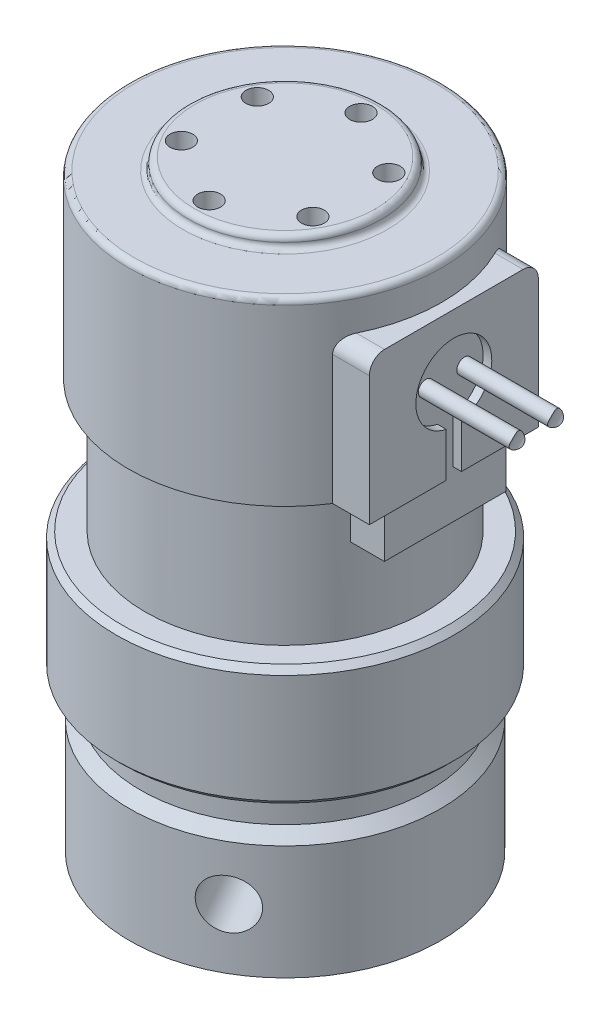
from build123d import *

# Parameters (mm, degrees)
CUT_EXTRUDE1_START             = -29.859510257
CUT_EXTRUDE1_OUTLINE_R         = 9.525
CUT_EXTRUDE1_DEPTH             = 38.80625
CUT_EXTRUDE1_START_2           = -19.623310357
CUT_EXTRUDE1_2_OUTLINE_R       = 10.2362
CUT_EXTRUDE1_2_OUTLINE_R_2     = 9.525
CUT_EXTRUDE1_2_DEPTH           = 28.5700501
CUT_EXTRUDE1_START_3           = -19.534410257
CUT_EXTRUDE1_3_OUTLINE_R       = 10.2362
CUT_EXTRUDE1_3_DEPTH           = 7.9248
CUT_EXTRUDE1_4_OUTLINE_R       = 10.2362
CUT_EXTRUDE1_4_OUTLINE_R_2     = 9.525
CUT_EXTRUDE1_4_DEPTH           = 7.5267999
CUT_EXTRUDE1_START_4           = -11.609610257
CUT_EXTRUDE1_5_OUTLINE_R       = 10.2362
CUT_EXTRUDE1_5_DEPTH           = 11.609610257
CUT_EXTRUDE1_START_5           = 4.949489743
CUT_EXTRUDE1_6_OUTLINE_R       = 10.2362
CUT_EXTRUDE1_6_DEPTH           = 3.99725
CUT_EXTRUDE1_START_6           = 6.730338354
CUT_EXTRUDE1_7_DEPTH           = 4.382161646
CUT_EXTRUDE1_START_7           = 9.523588486
CUT_EXTRUDE1_8_DEPTH           = 1.017411514
CUT_EXTRUDE1_START_8           = 29.859510257
CUT_EXTRUDE1_9_DEPTH           = 4.949489743
CUT_EXTRUDE2_DEPTH             = 7.9248
SKETCH3_R                      = 6.681
SKETCH3_R_2                    = 4.319
CUT_EXTRUDE3_DEPTH             = 1
CUT_EXTRUDE4_DEPTH             = 8.7001
CUT_EXTRUDE5_START             = -2.35625
CUT_EXTRUDE5_DEPTH             = 2.35625
CUT_EXTRUDE6_DEPTH             = 7.9248
CUT_EXTRUDE7_DEPTH             = 5.5372
SKETCH8_R                      = 2.413
BOSS_EXTRUDE1_DEPTH            = 3.675390567
BOSS_EXTRUDE2_REACH            = 48.481
BOSS_EXTRUDE2_END_RADIUS       = 0.85
SKETCH9_R                      = 0.5
BOSS_EXTRUDE3_REACH            = 48.481
BOSS_EXTRUDE3_END_RADIUS       = 0.85
SKETCH10_R                     = 0.5
M2_CLEARANCE_HOLE1_D           = 2.362
M2_CLEARANCE_HOLE1_DEPTH       = 9
HOLE1_D                        = 0.635
HOLE1_DEPTH                    = 14
F_1_5_1_5_DIAMETER_HOLE1_D     = 1.5
F_1_5_1_5_DIAMETER_HOLE1_DEPTH = 1.6
M3_CLEARANCE_HOLE1_D           = 3.2512
M3_CLEARANCE_HOLE1_DEPTH       = 4.99995
M3_CLEARANCE_HOLE2_D           = 3.2512
M3_CLEARANCE_HOLE2_DEPTH       = 4.99995
M3_CLEARANCE_HOLE3_D           = 3.2512
M3_CLEARANCE_HOLE3_DEPTH       = 4.99995
CHAMFER1_SIZE                  = 0.381
CHAMFER2_SIZE                  = 0.498
FILLET1_R                      = 0.386030378
FILLET2_R                      = 1


with BuildPart() as part:
    # Cut-Extrude1: read off the stored shape, not the designer's step
    # Cut-Extrude1 outline → Cut-Extrude1 (new body)
    with BuildSketch(Plane(origin=(0, 29.859510257, 0), x_dir=(-1, 0, 0), z_dir=(0, 1, 0)).offset(CUT_EXTRUDE1_START)):
        Circle(CUT_EXTRUDE1_OUTLINE_R)
    extrude(amount=CUT_EXTRUDE1_DEPTH)

    # Cut-Extrude1 2 outline → Cut-Extrude1 2 (add)
    with BuildSketch(Plane(origin=(0, 29.859510257, 0), x_dir=(-1, 0, 0), z_dir=(0, 1, 0)).offset(CUT_EXTRUDE1_START_2)):
        Circle(CUT_EXTRUDE1_2_OUTLINE_R)
        Circle(CUT_EXTRUDE1_2_OUTLINE_R_2, mode=Mode.SUBTRACT)
    extrude(amount=CUT_EXTRUDE1_2_DEPTH)

    # Cut-Extrude1 3 outline → Cut-Extrude1 3 (add)
    with BuildSketch(Plane(origin=(0, 29.859510257, 0), x_dir=(-1, 0, 0), z_dir=(0, 1, 0)).offset(CUT_EXTRUDE1_START_3)):
        with BuildLine():
            Line((-11.101245707, -0.5), (-11.1125, -0.5))
            Line((-11.1125, -0.5), (-11.1125, -5.5625))
            Line((-11.1125, -5.5625), (-9.620096153, -5.5625))
            ThreePointArc((-9.620096153, -5.5625), (10.665398665, 3.120405033), (-11.101245707, -0.5))
        make_face()
        Circle(CUT_EXTRUDE1_3_OUTLINE_R, mode=Mode.SUBTRACT)
    extrude(amount=CUT_EXTRUDE1_3_DEPTH)

    # Cut-Extrude1 4 outline → Cut-Extrude1 4 (add)
    with BuildSketch(Plane(origin=(0, 29.859510257, 0), x_dir=(-1, 0, 0), z_dir=(0, 1, 0)).offset(CUT_EXTRUDE1_START)):
        Circle(CUT_EXTRUDE1_4_OUTLINE_R)
        Circle(CUT_EXTRUDE1_4_OUTLINE_R_2, mode=Mode.SUBTRACT)
    extrude(amount=CUT_EXTRUDE1_4_DEPTH)

    # Cut-Extrude1 5 outline → Cut-Extrude1 5 (add)
    with BuildSketch(Plane(origin=(0, 29.859510257, 0), x_dir=(-1, 0, 0), z_dir=(0, 1, 0)).offset(CUT_EXTRUDE1_START_4)):
        with BuildLine():
            Line((-10.541, -0.5), (-11.1125, -0.5))
            Line((-11.1125, -0.5), (-11.1125, -5.5625))
            Line((-11.1125, -5.5625), (-8.691098625, -5.5625))
            ThreePointArc((-8.691098625, -5.5625), (10.31875, 0), (-8.691098625, 5.5625))
            Line((-8.691098625, 5.5625), (-11.1125, 5.5625))
            Line((-11.1125, 5.5625), (-11.1125, 0.5))
            Line((-11.1125, 0.5), (-10.541, 0.5))
            Line((-10.541, 0.5), (-10.541, -0.5))
        make_face()
        Circle(CUT_EXTRUDE1_5_OUTLINE_R, mode=Mode.SUBTRACT)
    extrude(amount=CUT_EXTRUDE1_5_DEPTH)

    # Cut-Extrude1 6 outline → Cut-Extrude1 6 (add)
    with BuildSketch(Plane(origin=(0, 29.859510257, 0), x_dir=(-1, 0, 0), z_dir=(0, 1, 0)).offset(CUT_EXTRUDE1_START_5)):
        with BuildLine():
            Line((-11.1125, -5.5625), (-8.691098625, -5.5625))
            ThreePointArc((-8.691098625, -5.5625), (10.31875, 0), (-8.691098625, 5.5625))
            Line((-8.691098625, 5.5625), (-11.1125, 5.5625))
            Line((-11.1125, 5.5625), (-11.1125, -5.5625))
        make_face()
        Circle(CUT_EXTRUDE1_6_OUTLINE_R, mode=Mode.SUBTRACT)
    extrude(amount=CUT_EXTRUDE1_6_DEPTH)

    # Cut-Extrude1 7 outline → Cut-Extrude1 7 (add)
    with BuildSketch(Plane.YZ.offset(CUT_EXTRUDE1_START_6)):
        with BuildLine():
            Line((34.809, 0), (34.809, 5.5625))
            Line((34.809, 5.5625), (29.859510257, 5.5625))
            Line((29.859510257, 5.5625), (29.859510257, 0.5))
            ThreePointArc((29.859510257, 0.5), (32.560272405, 2.487340383), (34.809, 0))
        make_face()
        with BuildLine():
            Line((34.809, -5.5625), (34.809, 0))
            ThreePointArc((34.809, 0), (32.560272405, -2.487340383), (29.859510257, -0.5))
            Line((29.859510257, -0.5), (29.859510257, -5.5625))
            Line((29.859510257, -5.5625), (34.809, -5.5625))
        make_face()
    extrude(amount=CUT_EXTRUDE1_7_DEPTH)

    # Cut-Extrude1 8 outline → Cut-Extrude1 8 (add)
    with BuildSketch(Plane.YZ.offset(CUT_EXTRUDE1_START_7)):
        with BuildLine():
            ThreePointArc((29.859510257, -0.5), (34.809, 0), (29.859510257, 0.5))
            Line((29.859510257, 0.5), (29.859510257, -0.5))
        make_face()
    extrude(amount=CUT_EXTRUDE1_8_DEPTH)

    # Cut-Extrude1 9 outline → Cut-Extrude1 9 (add)
    with BuildSketch(Plane(origin=(0, 0, 0), x_dir=(1, 0, 0), z_dir=(0, 1, 0)).offset(CUT_EXTRUDE1_START_8)):
        with BuildLine():
            ThreePointArc((8.592926404, -5.5625), (-10.2362, 0), (8.592926404, 5.5625))
            Line((8.592926404, 5.5625), (8.691098625, 5.5625))
            ThreePointArc((8.691098625, 5.5625), (-10.31875, 0), (8.691098625, -5.5625))
            Line((8.691098625, -5.5625), (8.592926404, -5.5625))
        make_face()
    extrude(amount=CUT_EXTRUDE1_9_DEPTH)

    # Cut-Extrude1 10 outline → Cut-Extrude1 10 (revolve)
    with BuildSketch(Plane.XY):
        Polygon((10.2362, 7.5268), (9.525, 8.238), (9.525, 7.5267999), align=None)
        Polygon((9.525, 10.2361999), (9.525, 9.525), (10.2362, 10.2362), align=None)
        with BuildLine():
            ThreePointArc((8.609999999, -0.324609433), (8.744308814, -0.177391442), (8.835106781, 0))
            Line((8.835106781, 0), (7.420893219, 0))
            ThreePointArc((7.420893219, 0), (7.511691186, -0.177391442), (7.646000001, -0.324609433))
            Line((7.646000001, -0.324609433), (8.609999999, -0.324609433))
        make_face()
        with BuildLine():
            ThreePointArc((8.128000003, -0.5), (8.384459477, -0.454789711), (8.609999999, -0.324609433))
            Line((8.609999999, -0.324609433), (7.646000001, -0.324609433))
            ThreePointArc((7.646000001, -0.324609433), (7.871540526, -0.454789712), (8.128000003, -0.5))
        make_face()
        with BuildLine():
            ThreePointArc((3.376999999, -0.324609433), (3.511308814, -0.177391442), (3.602106781, 0))
            Line((3.602106781, 0), (0, 0))
            Line((0, 0), (0, -0.324609433))
            Line((0, -0.324609433), (2.413, -0.324609433))
            Line((2.413, -0.324609433), (3.376999999, -0.324609433))
        make_face()
        with BuildLine():
            ThreePointArc((2.895, -0.5), (3.151459475, -0.454789711), (3.376999999, -0.324609433))
            Line((3.376999999, -0.324609433), (2.413, -0.324609433))
            ThreePointArc((2.413, -0.324609433), (2.638540524, -0.454789711), (2.895, -0.5))
        make_face()
        with BuildLine():
            Line((3.602106781, 39.60008858), (3.602106781, 38.80625))
            Line((3.602106781, 38.80625), (6.693887254, 38.80625))
            ThreePointArc((6.693887254, 38.80625), (6.437149688, 38.931287401), (6.349669127, 39.203125))
            ThreePointArc((6.349669127, 39.203125), (6.23566623, 39.486273695), (5.952406329, 39.6))
            Line((5.952406329, 39.6), (3.602106781, 39.60008858))
        make_face()
        Polygon((0, 38.80625), (3.602106781, 38.80625), (3.602106781, 39.60008858), (0, 39.6), align=None)
    revolve(axis=Axis((0, 0, 0), (0, 1, 0)))

    # Cut-Extrude1 11 outline → Cut-Extrude1 11 (revolve, cut)
    with BuildSketch(Plane.XY):
        with BuildLine():
            ThreePointArc((6.693887254, 38.80625), (6.712112754, 38.805793407), (6.730338254, 38.80625))
            Line((6.730338254, 38.80625), (6.693887254, 38.80625))
        make_face()
    revolve(axis=Axis((0, 0, 0), (0, 1, 0)), mode=Mode.SUBTRACT)

    # Sketch2 → Cut-Extrude2 (cut)
    with BuildSketch(Plane.XZ.offset(-10.3251)):
        with BuildLine():
            Line((11.1125, -0.5), (11.101245707, -0.5))
            ThreePointArc((11.101245707, -0.5), (10.92581766, -2.028340381), (10.541, -3.517808302))
            Line((10.541, -3.517808302), (10.541, -4))
            Line((10.541, -4), (10.367625391, -4))
            ThreePointArc((10.367625391, -4), (10.024350587, -4.795836898), (9.620096153, -5.5625))
            Line((9.620096153, -5.5625), (11.1125, -5.5625))
            Line((11.1125, -5.5625), (11.1125, -0.5))
        make_face()
    extrude(amount=-CUT_EXTRUDE2_DEPTH, mode=Mode.SUBTRACT)

    # Sketch3 → Cut-Extrude3 (cut)
    with BuildSketch(Plane.XZ):
        with Locations(Location((0, 0, 0), (0, 0, 90))):
            Circle(SKETCH3_R)
        with Locations(Location((0, 0, 0), (0, 0, 90))):
            Circle(SKETCH3_R_2, mode=Mode.SUBTRACT)
    extrude(amount=-CUT_EXTRUDE3_DEPTH, mode=Mode.SUBTRACT)

    # Sketch4 → Cut-Extrude4 (cut)
    with BuildSketch(Plane.XZ.offset(-18.2499)):
        with BuildLine():
            Line((10.541, -4), (8.307129468, -4))
            ThreePointArc((8.307129468, -4), (-9.22, 0), (8.307129468, 4))
            Line((8.307129468, 4), (10.541, 4))
            Line((10.541, 4), (10.541, 0.5))
            Line((10.541, 0.5), (11.1125, 0.5))
            Line((11.1125, 0.5), (11.1125, 5.5625))
            Line((11.1125, 5.5625), (8.691098625, 5.5625))
            ThreePointArc((8.691098625, 5.5625), (-10.31875, 0), (8.691098625, -5.5625))
            Line((8.691098625, -5.5625), (11.1125, -5.5625))
            Line((11.1125, -5.5625), (11.1125, -0.5))
            Line((11.1125, -0.5), (10.541, -0.5))
            Line((10.541, -0.5), (10.541, -4))
        make_face()
    extrude(amount=-CUT_EXTRUDE4_DEPTH, mode=Mode.SUBTRACT)

    # Sketch5 → Cut-Extrude5 (cut)
    with BuildSketch(Plane(origin=(0, 38.80625, 0), x_dir=(-1, 0, 0), z_dir=(0, 1, 0)).offset(CUT_EXTRUDE5_START)):
        with BuildLine():
            Line((-8.691098625, 5.5625), (-11.1125, 5.5625))
            Line((-11.1125, 5.5625), (-11.1125, -5.5625))
            Line((-11.1125, -5.5625), (-8.691098625, -5.5625))
            ThreePointArc((-8.691098625, -5.5625), (-10.31875, 0), (-8.691098625, 5.5625))
        make_face()
    extrude(amount=CUT_EXTRUDE5_DEPTH, mode=Mode.SUBTRACT)

    # Sketch6 → Cut-Extrude6 (cut)
    with BuildSketch(Plane.XZ.offset(-10.3251)):
        with BuildLine():
            Line((10.541, -4), (10.541, -3.517808302))
            ThreePointArc((10.541, -3.517808302), (10.457092385, -3.759903603), (10.367625391, -4))
            Line((10.367625391, -4), (10.541, -4))
        make_face()
    extrude(amount=-CUT_EXTRUDE6_DEPTH, mode=Mode.SUBTRACT)

    # Sketch7 → Cut-Extrude7 (cut)
    with BuildSketch(Plane.XZ.offset(-18.2499)):
        with BuildLine():
            Line((10.541, 4), (8.307129468, 4))
            ThreePointArc((8.307129468, 4), (9.22, 0), (8.307129468, -4))
            Line((8.307129468, -4), (10.541, -4))
            Line((10.541, -4), (10.541, 4))
        make_face()
    extrude(amount=-CUT_EXTRUDE7_DEPTH, mode=Mode.SUBTRACT)

    # Sketch8 → Boss-Extrude1 (add)
    with BuildSketch(Plane.XZ.offset(0.324609433)):
        with Locations(Location((0, 0, 0), (0, 0, 270))):
            Circle(SKETCH8_R)
    extrude(amount=BOSS_EXTRUDE1_DEPTH)

    # Boss-Extrude2: up to this cylinder (the profile starts outside it)
    boss_extrude2_end = Plane(origin=(17.312613646, 32.309, 1.27), z_dir=(0, -0.7071067811865401, 0.7071067811865548)) * Cylinder(BOSS_EXTRUDE2_END_RADIUS, 99.662, mode=Mode.PRIVATE)
    # Sketch9 → Boss-Extrude2 (add, up to the surface)
    with BuildSketch(Plane(origin=(10.541, 0, 0), x_dir=(0, 0, -1), z_dir=(1, 0, 0)), mode=Mode.PRIVATE) as boss_extrude2_sk1:
        with Locations(Location((-1.27, 32.309, 0), (0, 0, 270))):
            Circle(SKETCH9_R)
    boss_extrude2_tool1 = extrude(boss_extrude2_sk1.sketch, amount=BOSS_EXTRUDE2_REACH, mode=Mode.PRIVATE) - boss_extrude2_end
    add(boss_extrude2_tool1.solids().sort_by_distance((10.541, 32.309, 1.27))[0])

    # Boss-Extrude3: up to this cylinder (the profile starts outside it)
    boss_extrude3_end = Plane(origin=(17.312613646, 32.309, -1.27), z_dir=(0, -0.7071067811865401, 0.7071067811865548)) * Cylinder(BOSS_EXTRUDE3_END_RADIUS, 99.662, mode=Mode.PRIVATE)
    # Sketch10 → Boss-Extrude3 (add, up to the surface)
    with BuildSketch(Plane(origin=(10.541, 0, 0), x_dir=(0, 0, -1), z_dir=(1, 0, 0)), mode=Mode.PRIVATE) as boss_extrude3_sk1:
        with Locations(Location((1.27, 32.309, 0), (0, 0, 270))):
            Circle(SKETCH10_R)
    boss_extrude3_tool1 = extrude(boss_extrude3_sk1.sketch, amount=BOSS_EXTRUDE3_REACH, mode=Mode.PRIVATE) - boss_extrude3_end
    add(boss_extrude3_tool1.solids().sort_by_distance((10.541, 32.309, -1.27))[0])

    # M2 Clearance Hole1
    with Locations(Plane(origin=(0, 1, 0), x_dir=(-1, 0, 0), z_dir=(0, -1, 0))):
        with Locations((-5.5, 0)):
            Hole(M2_CLEARANCE_HOLE1_D / 2, depth=M2_CLEARANCE_HOLE1_DEPTH)

    # Hole1
    with Locations(Plane(origin=(0, -4, 0), x_dir=(-1, 0, 0), z_dir=(0, -1, 0))):
        with Locations((0, 0)):
            Hole(HOLE1_D / 2, depth=HOLE1_DEPTH)

    # Ø1.5 (1.5) Diameter Hole1
    with Locations(Plane(origin=(0, 39.6, 0), x_dir=(1, 0, 0), z_dir=(0, 1, 0))):
        with Locations((4.330127019, 2.5), (0, 5), (-4.330127019, 2.5), (-4.330127019, -2.5), (0, -5), (4.330127019, -2.5)):
            Hole(F_1_5_1_5_DIAMETER_HOLE1_D / 2, depth=F_1_5_1_5_DIAMETER_HOLE1_DEPTH)

    # M3 Clearance Hole1
    with Locations(Plane(origin=(-10.2362, 3.962, 0), x_dir=(0, 0, -1), z_dir=(-1, 0, 0))):
        with Locations((0, 0)):
            Hole(M3_CLEARANCE_HOLE1_D / 2, depth=M3_CLEARANCE_HOLE1_DEPTH)

    # M3 Clearance Hole2
    with Locations(Plane(origin=(5.1181, 3.962, -8.864809238), x_dir=(-0.866025403784, 0, -0.5), z_dir=(0.5, 0, -0.866025403784))):
        with Locations((0, 0)):
            Hole(M3_CLEARANCE_HOLE2_D / 2, depth=M3_CLEARANCE_HOLE2_DEPTH)

    # M3 Clearance Hole3
    with Locations(Plane(origin=(5.1181, 3.962, 8.864809238), x_dir=(0.866025403784, 0, -0.5), z_dir=(0.5, 0, 0.866025403784))):
        with Locations((0, 0)):
            Hole(M3_CLEARANCE_HOLE3_D / 2, depth=M3_CLEARANCE_HOLE3_DEPTH)

    # Chamfer1
    chamfer1_edges = [part.edges().sort_by_distance(p)[0] for p in [
        (-11.078700497, 18.249900001, 0.866055168),
        (-10.665398665, 10.3251, 3.120405033),
    ]]
    chamfer(chamfer1_edges, length=CHAMFER1_SIZE)

    # Chamfer2
    chamfer2_edges = [part.edges().sort_by_distance(p)[0] for p in [
        (0, -4, 2.413),
    ]]
    chamfer(chamfer2_edges, length=CHAMFER2_SIZE)

    # Fillet1
    fillet1_edges = [part.edges().sort_by_distance(p)[0] for p in [
        (-10.31875, 38.80625, 0),
    ]]
    fillet(fillet1_edges, radius=FILLET1_R)

    # Fillet2
    # the kernel refuses this fillet: 1 mm, written as the material it takes off along each edge
    with BuildSketch(Plane(origin=(13.6125, 36.45, -5.5625), x_dir=(0, -1, 0), z_dir=(-1, 0, 0))) as fillet2_piece_1_section:
        with BuildLine():
            CenterArc((FILLET2_R, FILLET2_R), FILLET2_R, 180, 90)
            Line((0, FILLET2_R), (0, 0))
            Line((0, 0), (FILLET2_R, 0))
        make_face()
    fillet2_piece_1 = extrude(amount=7.421401375, mode=Mode.PRIVATE)
    fillet2_piece_1 = fillet2_piece_1 - Plane(origin=(0, 36.45, 0), x_dir=(0.8422627377489024, 0, -0.5390672319847718), z_dir=(0, -1, 0)) * Cylinder(10.31875, 19, mode=Mode.PRIVATE)
    add(fillet2_piece_1, mode=Mode.SUBTRACT)
    with BuildSketch(Plane(origin=(6.191098625, 36.45, 5.5625), x_dir=(0, -1, 0), z_dir=(1, 0, 0))) as fillet2_piece_2_section:
        with BuildLine():
            CenterArc((FILLET2_R, FILLET2_R), FILLET2_R, 180, 90)
            Line((0, FILLET2_R), (0, 0))
            Line((0, 0), (FILLET2_R, 0))
        make_face()
    fillet2_piece_2 = extrude(amount=7.421401375, mode=Mode.PRIVATE)
    fillet2_piece_2 = fillet2_piece_2 - Plane(origin=(0, 36.45, 0), x_dir=(0.8422627377489024, 0, -0.5390672319847718), z_dir=(0, -1, 0)) * Cylinder(10.31875, 19, mode=Mode.PRIVATE)
    add(fillet2_piece_2, mode=Mode.SUBTRACT)


solid = part.part
